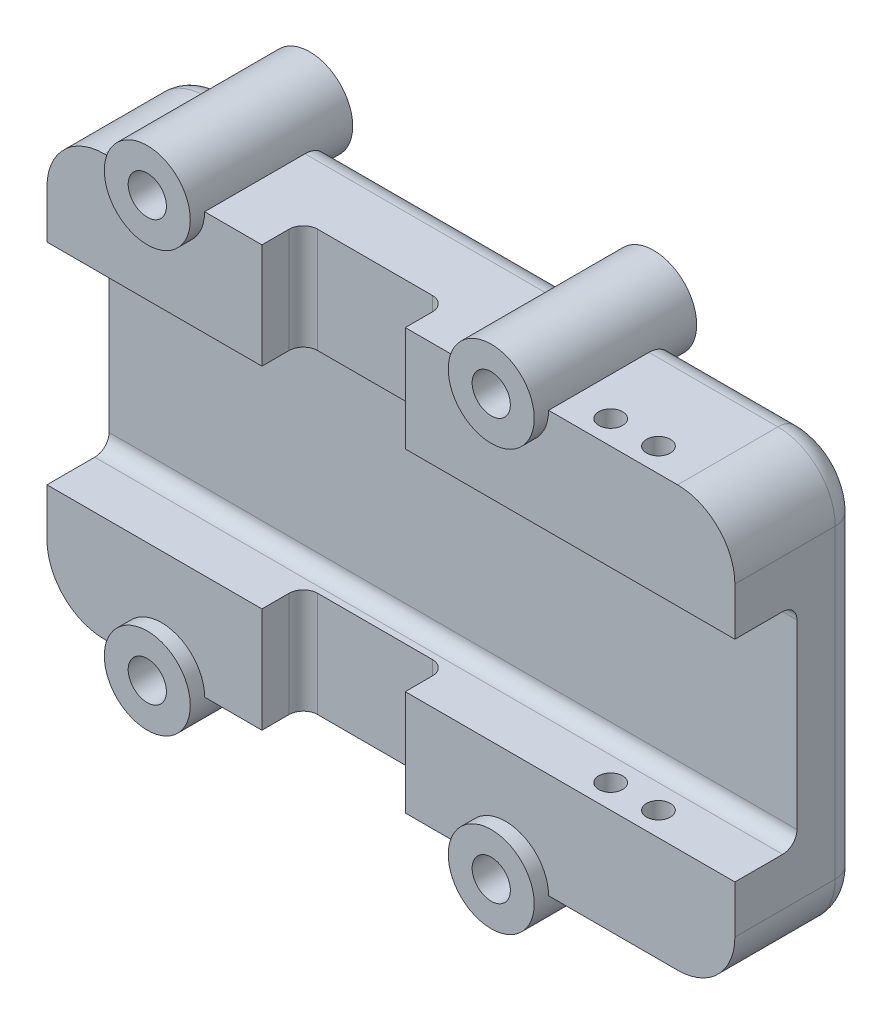
from build123d import *

# Parameters (mm, degrees)
SKETCH1_W               = 72
SKETCH1_H               = 40
BOSS_EXTRUDE1_DEPTH     = 26
BOSS_EXTRUDE3_START     = -5
SKETCH1_4_R             = 9
SKETCH1_4_R_2           = 4
BOSS_EXTRUDE3_DEPTH     = 34
CUT_EXTRUDE2_DEPTH      = 177.028406798
CUT_EXTRUDE2_DEPTH_BACK = 177.028406798
CUT_EXTRUDE3_DEPTH      = 177.028406798
CUT_EXTRUDE3_DEPTH_BACK = 177.028406798
SKETCH3_R               = 2.5
FILLET1_R               = 5


with BuildPart() as part:
    # Sketch1 → Boss-Extrude1 (new body)
    # profile 1 of 2: a face of its own
    with BuildSketch(Plane.XY):
        with BuildLine():
            Line((87, 88), (33, 88))
            ThreePointArc((33, 88), (24, 79), (15, 88))
            Line((15, 88), (12, 88))
            ThreePointArc((12, 88), (3.514718626, 84.485281374), (0, 76))
            Line((0, 76), (0, 12))
            ThreePointArc((0, 12), (3.514718626, 3.514718626), (12, 0))
            Line((12, 0), (15, 0))
            ThreePointArc((15, 0), (24, 9), (33, 0))
            Line((33, 0), (87, 0))
            ThreePointArc((87, 0), (96, 9), (105, 0))
            Line((105, 0), (132, 0))
            ThreePointArc((132, 0), (140.485281374, 3.514718626), (144, 12))
            Line((144, 12), (144, 76))
            ThreePointArc((144, 76), (140.485281374, 84.485281374), (132, 88))
            Line((132, 88), (105, 88))
            ThreePointArc((105, 88), (96, 79), (87, 88))
        make_face()
        with Locations((72, 44)):
            Rectangle(SKETCH1_W, SKETCH1_H, mode=Mode.SUBTRACT)
    # profile 2 of 2: a face of its own
    with BuildSketch(Plane.XY):
        with Locations((72, 44)):
            Rectangle(SKETCH1_W, SKETCH1_H)
    extrude(amount=BOSS_EXTRUDE1_DEPTH)

    # Sketch1<4> → Boss-Extrude3 (add)
    # profile 1 of 4: a face of its own
    with BuildSketch(Plane.XY.offset(BOSS_EXTRUDE3_START)):
        with Locations((24, 88)):
            Circle(SKETCH1_4_R)
        with Locations((24, 88)):
            Circle(SKETCH1_4_R_2, mode=Mode.SUBTRACT)
    # profile 2 of 4: a face of its own
    with BuildSketch(Plane.XY.offset(BOSS_EXTRUDE3_START)):
        with Locations((96, 88)):
            Circle(SKETCH1_4_R)
        with Locations((96, 88)):
            Circle(SKETCH1_4_R_2, mode=Mode.SUBTRACT)
    # profile 3 of 4: a face of its own
    with BuildSketch(Plane.XY.offset(BOSS_EXTRUDE3_START)):
        with Locations((96, 0)):
            Circle(SKETCH1_4_R)
        with Locations((96, 0)):
            Circle(SKETCH1_4_R_2, mode=Mode.SUBTRACT)
    # profile 4 of 4: a face of its own
    with BuildSketch(Plane.XY.offset(BOSS_EXTRUDE3_START)):
        with Locations((24, 0)):
            Circle(SKETCH1_4_R)
        with Locations((24, 0)):
            Circle(SKETCH1_4_R_2, mode=Mode.SUBTRACT)
    extrude(amount=BOSS_EXTRUDE3_DEPTH)

    # Sketch2 → Cut-Extrude2 (cut, two sides: drawn at the far end of the back side and taken through both)
    with BuildSketch(Plane(origin=(0, 0, 0), x_dir=(0, 0, -1), z_dir=(1, 0, 0)).offset(-CUT_EXTRUDE2_DEPTH_BACK)):
        with BuildLine():
            Line((-13, 25), (-13, 63))
            ThreePointArc((-13, 63), (-13.878679656, 65.121320344), (-16, 66))
            Line((-16, 66), (-26, 66))
            Line((-26, 66), (-26, 22))
            Line((-26, 22), (-16, 22))
            ThreePointArc((-16, 22), (-13.878679656, 22.878679656), (-13, 25))
        make_face()
    extrude(amount=CUT_EXTRUDE2_DEPTH + CUT_EXTRUDE2_DEPTH_BACK, mode=Mode.SUBTRACT)

    # Sketch3 → Cut-Extrude3 (cut, two sides: drawn at the far end of the back side and taken through both)
    with BuildSketch(Plane(origin=(0, 0, 0), x_dir=(1, 0, 0), z_dir=(0, 1, 0)).offset(-CUT_EXTRUDE3_DEPTH_BACK)):
        with Locations(Location((113, -21, 0), (0, 0, 270))):
            Circle(SKETCH3_R)
        with Locations(Location((123, -21, 0), (0, 0, 270))):
            Circle(SKETCH3_R)
        with BuildLine():
            Line((72, -17.333333333), (48, -17.333333333))
            ThreePointArc((48, -17.333333333), (45.878679656, -18.21201299), (45, -20.333333333))
            Line((45, -20.333333333), (45, -26))
            Line((45, -26), (75, -26))
            Line((75, -26), (75, -20.333333333))
            ThreePointArc((75, -20.333333333), (74.121320344, -18.21201299), (72, -17.333333333))
        make_face()
    extrude(amount=CUT_EXTRUDE3_DEPTH + CUT_EXTRUDE3_DEPTH_BACK, mode=Mode.SUBTRACT)

    # Fillet1
    # the kernel refuses this fillet: 5 mm, written as the material it takes off along each edge
    with BuildSketch(Plane(origin=(27.5, 88, 0), x_dir=(0, -1, 0), z_dir=(-1, 0, 0))) as fillet1_piece_1_section:
        with BuildLine():
            CenterArc((FILLET1_R, FILLET1_R), FILLET1_R, 180, 90)
            Line((0, FILLET1_R), (0, 0))
            Line((0, 0), (FILLET1_R, 0))
        make_face()
    fillet1_piece_1 = extrude(amount=15.5, mode=Mode.PRIVATE)
    fillet1_piece_1 = fillet1_piece_1 - Plane(origin=(24, 88, 2.038539575), x_dir=(1, 0, 0), z_dir=(0, 0, -1)) * Cylinder(9, 51, mode=Mode.PRIVATE)
    add(fillet1_piece_1, mode=Mode.SUBTRACT)
    with BuildSketch(Plane(origin=(99.5, 88, 0), x_dir=(0, -1, 0), z_dir=(-1, 0, 0))) as fillet1_piece_2_section:
        with BuildLine():
            CenterArc((FILLET1_R, FILLET1_R), FILLET1_R, 180, 90)
            Line((0, FILLET1_R), (0, 0))
            Line((0, 0), (FILLET1_R, 0))
        make_face()
    fillet1_piece_2 = extrude(amount=79, mode=Mode.PRIVATE)
    fillet1_piece_2 = fillet1_piece_2 - Plane(origin=(24, 88, 1.113779656), x_dir=(1, 0, 0), z_dir=(0, 0, -1)) * Cylinder(9, 178, mode=Mode.PRIVATE)
    fillet1_piece_2 = fillet1_piece_2 - Plane(origin=(96, 88, 1.113779656), x_dir=(1, 0, 0), z_dir=(0, 0, -1)) * Cylinder(9, 178, mode=Mode.PRIVATE)
    add(fillet1_piece_2, mode=Mode.SUBTRACT)
    with BuildSketch(Plane(origin=(132, 88, 0), x_dir=(0, -1, 0), z_dir=(-1, 0, 0))) as fillet1_piece_3_section:
        with BuildLine():
            CenterArc((FILLET1_R, FILLET1_R), FILLET1_R, 180, 90)
            Line((0, FILLET1_R), (0, 0))
            Line((0, 0), (FILLET1_R, 0))
        make_face()
    fillet1_piece_3 = extrude(amount=39.5, mode=Mode.PRIVATE)
    fillet1_piece_3 = fillet1_piece_3 - Plane(origin=(96, 88, 0.84758794), x_dir=(1, 0, 0), z_dir=(0, 0, -1)) * Cylinder(9, 99, mode=Mode.PRIVATE)
    add(fillet1_piece_3, mode=Mode.SUBTRACT)
    with BuildSketch(Plane(origin=(132, 76, 0), x_dir=(1, 0, 0), z_dir=(0, -1, 0))) as fillet1_piece_4:
        with BuildLine():
            CenterArc((12 - FILLET1_R, FILLET1_R), FILLET1_R, 270, 90)
            Line((12, FILLET1_R), (12, 0))
            Line((12, 0), (12 - FILLET1_R, 0))
        make_face()
    revolve(axis=Axis((132, 76, 0), (0, 0, 1)), revolution_arc=90, mode=Mode.SUBTRACT)
    with BuildSketch(Plane(origin=(144, 12, 0), x_dir=(-1, 0, 0), z_dir=(0, 1, 0)), Plane(origin=(0, 76, 0), x_dir=(1, 0, 0), z_dir=(0, -1, 0))) as fillet1_piece_5:
        with BuildLine():
            CenterArc((FILLET1_R, FILLET1_R), FILLET1_R, 180, 90)
            Line((0, FILLET1_R), (0, 0))
            Line((0, 0), (FILLET1_R, 0))
        make_face()
    extrude(amount=64, mode=Mode.SUBTRACT)
    with BuildSketch(Plane(origin=(132, 12, 0), x_dir=(0, -1, 0), z_dir=(-1, 0, 0))) as fillet1_piece_6:
        with BuildLine():
            CenterArc((12 - FILLET1_R, FILLET1_R), FILLET1_R, 270, 90)
            Line((12, FILLET1_R), (12, 0))
            Line((12, 0), (12 - FILLET1_R, 0))
        make_face()
    revolve(axis=Axis((132, 12, 0), (0, 0, 1)), revolution_arc=90, mode=Mode.SUBTRACT)
    with BuildSketch(Plane(origin=(92.5, 0, 0), x_dir=(0, 1, 0), z_dir=(1, 0, 0))) as fillet1_piece_7_section:
        with BuildLine():
            CenterArc((FILLET1_R, FILLET1_R), FILLET1_R, 180, 90)
            Line((0, FILLET1_R), (0, 0))
            Line((0, 0), (FILLET1_R, 0))
        make_face()
    fillet1_piece_7 = extrude(amount=39.5, mode=Mode.PRIVATE)
    fillet1_piece_7 = fillet1_piece_7 - Plane(origin=(96, 0, 1.166964438), x_dir=(1, 0, 0), z_dir=(0, 0, -1)) * Cylinder(9, 99, mode=Mode.PRIVATE)
    add(fillet1_piece_7, mode=Mode.SUBTRACT)
    with BuildSketch(Plane(origin=(20.5, 0, 0), x_dir=(0, 1, 0), z_dir=(1, 0, 0))) as fillet1_piece_8_section:
        with BuildLine():
            CenterArc((FILLET1_R, FILLET1_R), FILLET1_R, 180, 90)
            Line((0, FILLET1_R), (0, 0))
            Line((0, 0), (FILLET1_R, 0))
        make_face()
    fillet1_piece_8 = extrude(amount=79, mode=Mode.PRIVATE)
    fillet1_piece_8 = fillet1_piece_8 - Plane(origin=(96, 0, 1.113779656), x_dir=(1, 0, 0), z_dir=(0, 0, -1)) * Cylinder(9, 178, mode=Mode.PRIVATE)
    fillet1_piece_8 = fillet1_piece_8 - Plane(origin=(24, 0, 1.113779656), x_dir=(1, 0, 0), z_dir=(0, 0, -1)) * Cylinder(9, 178, mode=Mode.PRIVATE)
    add(fillet1_piece_8, mode=Mode.SUBTRACT)
    with BuildSketch(Plane(origin=(12, 0, 0), x_dir=(0, 1, 0), z_dir=(1, 0, 0))) as fillet1_piece_9_section:
        with BuildLine():
            CenterArc((FILLET1_R, FILLET1_R), FILLET1_R, 180, 90)
            Line((0, FILLET1_R), (0, 0))
            Line((0, 0), (FILLET1_R, 0))
        make_face()
    fillet1_piece_9 = extrude(amount=15.5, mode=Mode.PRIVATE)
    fillet1_piece_9 = fillet1_piece_9 - Plane(origin=(24, 0, 0.994853316), x_dir=(1, 0, 0), z_dir=(0, 0, -1)) * Cylinder(9, 51, mode=Mode.PRIVATE)
    add(fillet1_piece_9, mode=Mode.SUBTRACT)
    with BuildSketch(Plane(origin=(12, 12, 0), x_dir=(-1, 0, 0), z_dir=(0, 1, 0))) as fillet1_piece_10:
        with BuildLine():
            CenterArc((12 - FILLET1_R, FILLET1_R), FILLET1_R, 270, 90)
            Line((12, FILLET1_R), (12, 0))
            Line((12, 0), (12 - FILLET1_R, 0))
        make_face()
    revolve(axis=Axis((12, 12, 0), (0, 0, 1)), revolution_arc=90, mode=Mode.SUBTRACT)
    with BuildSketch(Plane(origin=(12, 76, 0), x_dir=(0, 1, 0), z_dir=(1, 0, 0))) as fillet1_piece_11:
        with BuildLine():
            CenterArc((12 - FILLET1_R, FILLET1_R), FILLET1_R, 270, 90)
            Line((12, FILLET1_R), (12, 0))
            Line((12, 0), (12 - FILLET1_R, 0))
        make_face()
    revolve(axis=Axis((12, 76, 0), (0, 0, 1)), revolution_arc=90, mode=Mode.SUBTRACT)


solid = part.part
